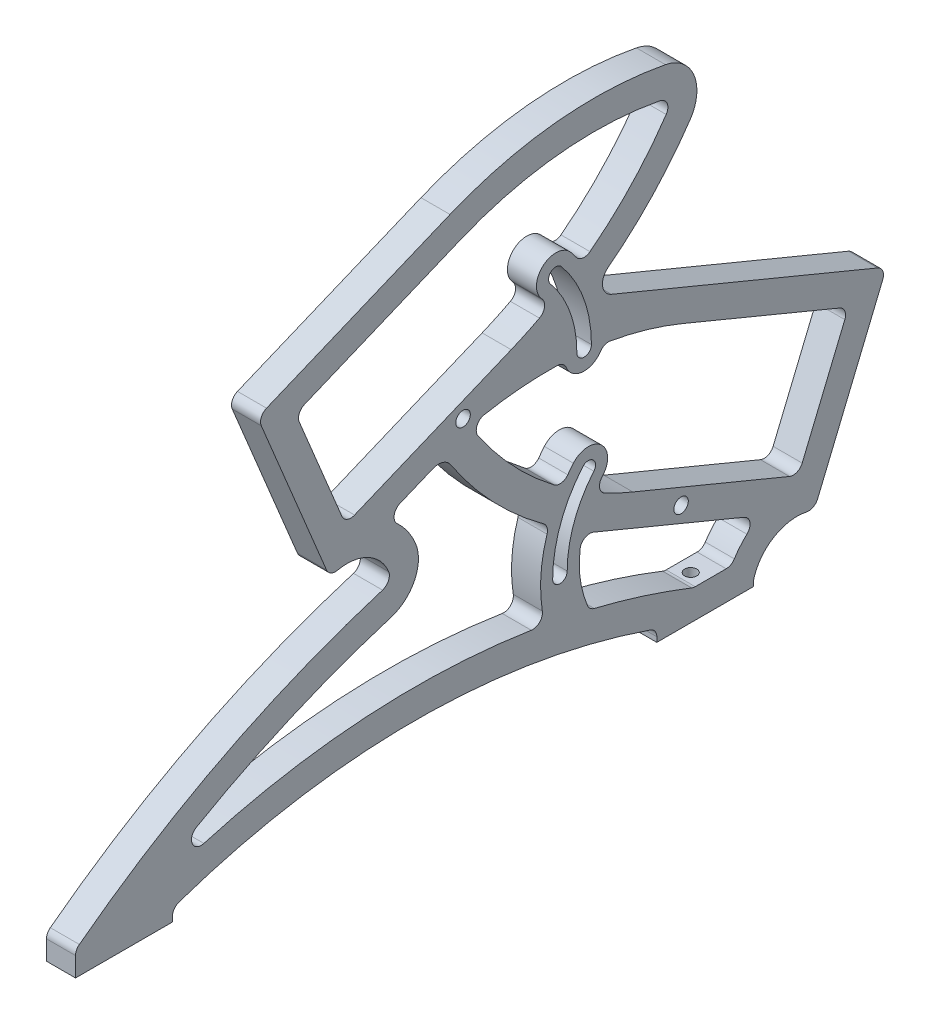
from build123d import *

# Parameters (mm, degrees)
SKETCH1_R                   = 1.5
BOSS_EXTRUDE1_DEPTH         = 6
FILLET1_R                   = 2
TAP_DRILL_FOR_M3_TAP1_D     = 2.5
TAP_DRILL_FOR_M3_TAP1_DEPTH = 10
TAP_DRILL_FOR_M3_TAP1_TIP   = 0.751075774


with BuildPart() as part:
    # Sketch1 → Boss-Extrude1 (new body)
    with BuildSketch(Plane(origin=(0, 0, 0), x_dir=(0, 0, -1), z_dir=(1, 0, 0))):
        with BuildLine():
            Line((0, 0), (0, 5))
            ThreePointArc((0, 5), (30.219883345, 24.178261263), (63.374200296, 37.663005309))
            ThreePointArc((63.374200296, 37.663005309), (64.598387059, 38.722473063), (64.63724154, 40.340989509))
            ThreePointArc((64.63724154, 40.340989509), (59.61305605, 45.365174999), (52.507784789, 45.365174999))
            Line((52.507784789, 45.365174999), (37.583130927, 81.396476767))
            Line((37.583130927, 81.396476767), (77.309950825, 97.851864359))
            ThreePointArc((77.309950825, 97.851864359), (99.212126708, 103.382032684), (121.780388401, 102.401403174))
            ThreePointArc((121.780388401, 102.401403174), (127.669990403, 97.605027848), (126.896962407, 90.048900815))
            ThreePointArc((126.896962407, 90.048900815), (119.14091097, 80.382032042), (109.95108442, 72.066277489))
            ThreePointArc((109.95108442, 72.066277489), (108.806760877, 69.295132272), (110.63276103, 66.917224446))
            Line((110.63276103, 66.917224446), (167.416869073, 43.396476767))
            Line((167.416869073, 43.396476767), (152.492215211, 7.365174999))
            ThreePointArc((152.492215211, 7.365174999), (145.029217261, 7.208101321), (140.094434117, 1.607304426))
            ThreePointArc((140.094434117, 1.607304426), (140.023749539, 1.307301346), (140, 1))
            Line((140, 1), (140, 0))
            Line((140, 0), (120, 0))
            Line((120, 0), (120, 1))
            ThreePointArc((120, 1), (119.627466942, 2.162476387), (118.648648649, 2.891891892))
            ThreePointArc((118.648648649, 2.891891892), (70, 11), (21.351351351, 2.891891892))
            ThreePointArc((21.351351351, 2.891891892), (20.372533058, 2.162476387), (20, 1))
            Line((20, 1), (20, 0))
            Line((20, 0), (0, 0))
        make_face()
        with Locations((80, 60)):
            Circle(SKETCH1_R, mode=Mode.SUBTRACT)
        with Locations((125, 22)):
            Circle(SKETCH1_R, mode=Mode.SUBTRACT)
        with BuildLine():
            Line((63.72452745, 50.011301935), (73.778180922, 54.175661554))
            ThreePointArc((73.778180922, 54.175661554), (75.808425028, 54.271379594), (77.433736974, 53.050964027))
            ThreePointArc((77.433736974, 53.050964027), (86.620787631, 41.585096636), (97.795743326, 32.046313693))
            ThreePointArc((97.795743326, 32.046313693), (96.034595754, 23.416106233), (96.9455023, 14.655263189))
            ThreePointArc((96.9455023, 14.655263189), (52.941269217, 16.064501754), (10.295761295, 5.122877714))
            ThreePointArc((10.295761295, 5.122877714), (36.65145318, 20.693819549), (65.128353757, 31.925153304))
            ThreePointArc((65.128353757, 31.925153304), (70.02510081, 36.163024322), (70.180518735, 42.637090103))
            ThreePointArc((70.180518735, 42.637090103), (67.559666076, 46.855738901), (63.72452745, 50.011301935))
        make_face(mode=Mode.SUBTRACT)
        with BuildLine():
            Line((89.938504093, 67.363839786), (55.75496139, 53.204552788))
            Line((55.75496139, 53.204552788), (45.422508716, 78.149300166))
            Line((45.422508716, 78.149300166), (79.606051419, 92.308587164))
            ThreePointArc((79.606051419, 92.308587164), (99.822768166, 97.41318715), (120.654312785, 96.508020979))
            ThreePointArc((120.654312785, 96.508020979), (122.126713173, 95.308927239), (121.933456188, 93.419895626))
            ThreePointArc((121.933456188, 93.419895626), (114.00738821, 83.695600474), (104.513091632, 75.495429604))
            ThreePointArc((104.513091632, 75.495429604), (103.417061907, 77.106759239), (102.21528885, 78.640840681))
            ThreePointArc((102.21528885, 78.640840681), (96.579960639, 79.133868015), (96.086933305, 73.498539803))
            ThreePointArc((96.086933305, 73.498539803), (96.970865757, 72.368901142), (97.775623152, 71.181557207))
            ThreePointArc((97.775623152, 71.181557207), (93.914921513, 69.15392617), (89.938504093, 67.363839786))
        make_face(mode=Mode.SUBTRACT)
        with BuildLine():
            Line((115.061495907, 29.363839786), (149.24503861, 15.204552788))
            Line((149.24503861, 15.204552788), (159.577491284, 40.149300166))
            Line((159.577491284, 40.149300166), (125.393948581, 54.308587164))
            ThreePointArc((125.393948581, 54.308587164), (117.264207727, 57.119606105), (108.857153356, 58.940581296))
            ThreePointArc((108.857153356, 58.940581296), (104.605856533, 56.019466), (101.009981848, 59.717590457))
            ThreePointArc((101.009981848, 59.717590457), (92.642614201, 59.598040233), (84.345687556, 58.508021044))
            ThreePointArc((84.345687556, 58.508021044), (82.873286995, 57.30892717), (83.066544007, 55.419895339))
            ThreePointArc((83.066544007, 55.419895339), (90.992611911, 45.695600349), (100.486908368, 37.495429604))
            ThreePointArc((100.486908368, 37.495429604), (101.582938093, 39.106759239), (102.78471115, 40.640840681))
            ThreePointArc((102.78471115, 40.640840681), (108.420039361, 41.133868015), (108.913066695, 35.498539803))
            ThreePointArc((108.913066695, 35.498539803), (108.029134243, 34.368901142), (107.224376848, 33.181557207))
            ThreePointArc((107.224376848, 33.181557207), (111.085078487, 31.15392617), (115.061495907, 29.363839786))
        make_face(mode=Mode.SUBTRACT)
        with BuildLine():
            Line((104.649474218, 27.182287179), (141.27547255, 12.011301935))
            ThreePointArc((141.27547255, 12.011301935), (137.950950961, 9.410732752), (135.464526627, 6))
            Line((135.464526627, 6), (127.541289523, 6))
            ThreePointArc((127.541289523, 6), (116.964502802, 9.762681734), (106.144506127, 12.754982379))
            ThreePointArc((106.144506127, 12.754982379), (104.111850842, 19.835461998), (104.649474218, 27.182287179))
        make_face(mode=Mode.SUBTRACT)
        with BuildLine():
            ThreePointArc((106.5, 60), (104.901854451, 69.063533798), (100.300177743, 77.033871657))
            ThreePointArc((100.300177743, 77.033871657), (98.186929663, 77.218756907), (98.002044413, 75.105508828))
            ThreePointArc((98.002044413, 75.105508828), (102.082776588, 68.037473368), (103.5, 60))
            ThreePointArc((103.5, 60), (105, 58.5), (106.5, 60))
        make_face(mode=Mode.SUBTRACT)
        with BuildLine():
            ThreePointArc((104.699822257, 39.033871657), (100.098145549, 31.063533798), (98.5, 22))
            ThreePointArc((98.5, 22), (100, 20.5), (101.5, 22))
            ThreePointArc((101.5, 22), (102.917223412, 30.037473368), (106.997955587, 37.105508828))
            ThreePointArc((106.997955587, 37.105508828), (106.813070337, 39.218756907), (104.699822257, 39.033871657))
        make_face(mode=Mode.SUBTRACT)
    extrude(amount=BOSS_EXTRUDE1_DEPTH)

    # Fillet1
    fillet1_edges = [part.edges().sort_by_distance(p)[0] for p in [
        (3, 14.655263189, -96.9455023),
        (3, 32.046313693, -97.795743326),
        (3, 27.182287179, -104.649474218),
        (3, 12.754982379, -106.144506127),
        (3, 12.011301935, -141.27547255),
        (3, 6, -135.464526627),
        (3, 6, -127.541289523),
        (3, 37.495429604, -100.486908368),
        (3, 33.181557207, -107.224376848),
        (3, 15.204552788, -149.24503861),
        (3, 40.149300166, -159.577491284),
        (3, 43.396476767, -167.416869073),
        (3, 7.365174999, -152.492215211),
        (3, 75.495429604, -104.513091632),
        (3, 71.181557207, -97.775623152),
        (3, 53.204552788, -55.75496139),
        (3, 81.396476767, -37.583130927),
        (3, 78.149300166, -45.422508716),
        (3, 45.365174999, -52.507784789),
        (3, 50.011301935, -63.72452745),
        (3, 5.122877714, -10.295761295),
        (3, 5, 0),
        (3, 58.940581296, -108.857153356),
        (3, 59.717590457, -101.009981848),
    ]]
    fillet(fillet1_edges, radius=FILLET1_R)

    # Tap Drill for M3 Tap1
    with Locations(Plane(origin=(0, 0, 0), x_dir=(-1, 0, 0), z_dir=(0, -1, 0))):
        with Locations((-3, 10), (-3, 130)):
            Hole(TAP_DRILL_FOR_M3_TAP1_D / 2, depth=TAP_DRILL_FOR_M3_TAP1_DEPTH)
            with Locations((0, 0, -(TAP_DRILL_FOR_M3_TAP1_DEPTH + TAP_DRILL_FOR_M3_TAP1_TIP / 2))):  # 118° drill point
                Cone(0, TAP_DRILL_FOR_M3_TAP1_D / 2, TAP_DRILL_FOR_M3_TAP1_TIP, mode=Mode.SUBTRACT)


solid = part.part
